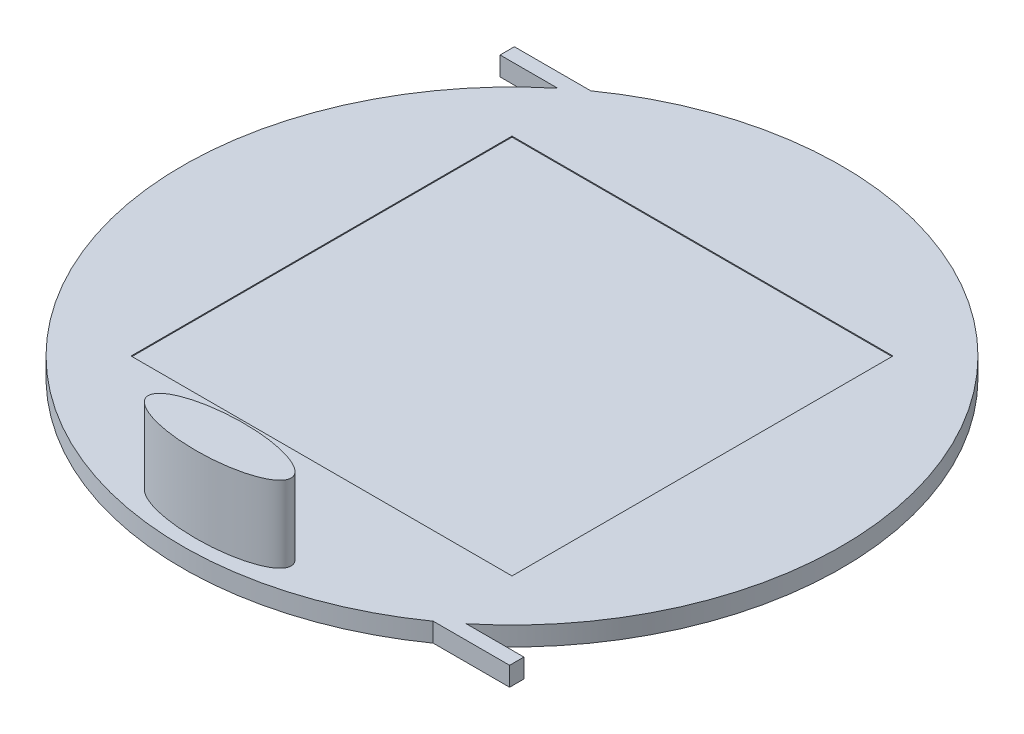
from build123d import *

# Parameters (mm, degrees)
BOSS_EXTRUDE1_DEPTH     = 2
SKETCH3_RX              = 7.5
SKETCH3_RY              = 2.5
BOSS_EXTRUDE2_DEPTH     = 8
SKETCH4_W               = 40
SKETCH4_H               = 40
CUT_EXTRUDE3_DEPTH      = 0.1
CUT_EXTRUDE4_DEPTH      = 22
CUT_EXTRUDE4_DEPTH_BACK = 21
SKETCH1_6_W             = 28
SKETCH1_6_H             = 1.5
EXTRUDE_THIN1_DEPTH     = 2


with BuildPart() as part:
    # Sketch1 → Boss-Extrude1 (new body)
    with BuildSketch(Plane(origin=(0, 0, 0), x_dir=(1, 0, 0), z_dir=(0, 1, 0))):
        with BuildLine():
            ThreePointArc((-20.997857034, 27.5), (-27.5, -20.997857034), (20.997857034, -27.5))
            ThreePointArc((20.997857034, -27.5), (27.5, 20.997857034), (-20.997857034, 27.5))
        make_face()
    extrude(amount=BOSS_EXTRUDE1_DEPTH)

    # Sketch3 → Boss-Extrude2 (add)
    with BuildSketch(Plane(origin=(0, 2, 0), x_dir=(1, 0, 0), z_dir=(0, 1, 0))):
        with Locations((0, -30.694699658)):
            Ellipse(SKETCH3_RX, SKETCH3_RY)
    extrude(amount=BOSS_EXTRUDE2_DEPTH)

    # Sketch4 → Cut-Extrude3 (cut)
    with BuildSketch(Plane(origin=(0, 2, 0), x_dir=(1, 0, 0), z_dir=(0, 1, 0))):
        Rectangle(SKETCH4_W, SKETCH4_H)
    extrude(amount=-CUT_EXTRUDE3_DEPTH, mode=Mode.SUBTRACT)

    # Sketch7 → Cut-Extrude4 (cut, two sides: drawn at the far end of the back side and taken through both)
    with BuildSketch(Plane.XY.offset(-CUT_EXTRUDE4_DEPTH_BACK)):
        Polygon((-34.6, 1), (-29.75, 0), (-34.6, 0), align=None)
    extrude(amount=CUT_EXTRUDE4_DEPTH + CUT_EXTRUDE4_DEPTH_BACK, mode=Mode.SUBTRACT)

    # Sketch1<6> → Extrude-Thin1 (add)
    with BuildSketch(Plane(origin=(0, 0, 0), x_dir=(1, 0, 0), z_dir=(0, 1, 0))):
        with Locations((-14, 27.5)):
            Rectangle(SKETCH1_6_W, SKETCH1_6_H)
        with Locations((14, -27.5)):
            Rectangle(SKETCH1_6_W, SKETCH1_6_H)
    extrude(amount=EXTRUDE_THIN1_DEPTH)


solid = part.part
